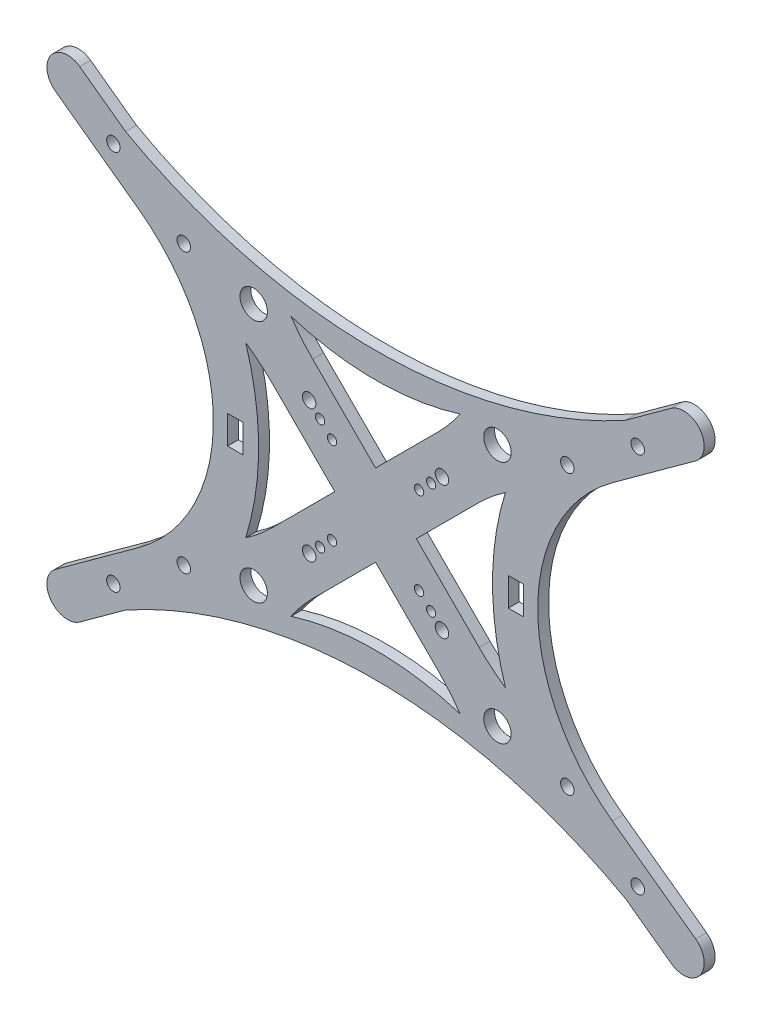
from build123d import *

# Parameters (mm, degrees)
SKETCH_7_R          = 1.075
SKETCH_7_R_2        = 1.55
SKETCH_7_R_3        = 3.15
SKETCH_7_R_4        = 3.150000003
EXTRUDE_2_5_DEPTH   = 2.5
CUT_EXTRUDE_2_DEPTH = 95.113928094
SKETCH_8_W          = 3.5
SKETCH_8_H          = 6.5
CUT_EXTRUDE_3_DEPTH = 95.113928094


with BuildPart() as part:
    # 草图7 → 主结构-厚度还是得2.5, 不然铝柱不好选 (new body)
    with BuildSketch(Plane.XY):
        with BuildLine():
            Line((-67.948496874, -55.238795586), (-57.42060576, -47.589834961))
            ThreePointArc((-57.42060576, -47.589834961), (0, -32.757979874), (57.42060576, -47.589834961))
            Line((57.42060576, -47.589834961), (67.948496874, -55.238795586))
            ThreePointArc((67.948496874, -55.238795586), (74.583307546, -54.187944811), (73.532456771, -47.55313414))
            Line((73.532456771, -47.55313414), (54.395000648, -33.648958388))
            ThreePointArc((54.395000648, -33.648958388), (37.25, 0), (54.395000648, 33.648958388))
            Line((54.395000648, 33.648958388), (73.532456771, 47.55313414))
            ThreePointArc((73.532456771, 47.55313414), (74.583307546, 54.187944811), (67.948496874, 55.238795586))
            Line((67.948496874, 55.238795586), (57.42060576, 47.589834961))
            ThreePointArc((57.42060576, 47.589834961), (0, 32.757979874), (-57.42060576, 47.589834961))
            Line((-57.42060576, 47.589834961), (-67.948496874, 55.238795586))
            ThreePointArc((-67.948496874, 55.238795586), (-74.583307546, 54.187944811), (-73.532456771, 47.55313414))
            Line((-73.532456771, 47.55313414), (-54.395000648, 33.648958388))
            ThreePointArc((-54.395000648, 33.648958388), (-37.25, 0), (-54.395000648, -33.648958388))
            Line((-54.395000648, -33.648958388), (-73.532456771, -47.55313414))
            ThreePointArc((-73.532456771, -47.55313414), (-74.583307546, -54.187944811), (-67.948496874, -55.238795586))
        make_face()
        with Locations((10, 10)):
            Circle(SKETCH_7_R, mode=Mode.SUBTRACT)
        with Locations((12.75, 12.75)):
            Circle(SKETCH_7_R, mode=Mode.SUBTRACT)
        with Locations((15.25, 15.25)):
            Circle(SKETCH_7_R_2, mode=Mode.SUBTRACT)
        with Locations((15.25, -15.25)):
            Circle(SKETCH_7_R_2, mode=Mode.SUBTRACT)
        with Locations((12.75, -12.75)):
            Circle(SKETCH_7_R, mode=Mode.SUBTRACT)
        with Locations((10, -10)):
            Circle(SKETCH_7_R, mode=Mode.SUBTRACT)
        with Locations((28, -28)):
            Circle(SKETCH_7_R_3, mode=Mode.SUBTRACT)
        with Locations((28, 28)):
            Circle(SKETCH_7_R_4, mode=Mode.SUBTRACT)
        with Locations((60.224561343, 43.755705046)):
            Circle(SKETCH_7_R_2, mode=Mode.SUBTRACT)
        with Locations((-60.224561343, 43.755705046)):
            Circle(SKETCH_7_R_2, mode=Mode.SUBTRACT)
        with Locations((-28, 28)):
            Circle(SKETCH_7_R_4, mode=Mode.SUBTRACT)
        with Locations((-28, -28)):
            Circle(SKETCH_7_R_3, mode=Mode.SUBTRACT)
        with Locations((-10, -10)):
            Circle(SKETCH_7_R, mode=Mode.SUBTRACT)
        with Locations((-12.75, -12.75)):
            Circle(SKETCH_7_R, mode=Mode.SUBTRACT)
        with Locations((-15.25, -15.25)):
            Circle(SKETCH_7_R_2, mode=Mode.SUBTRACT)
        with Locations((-15.25, 15.25)):
            Circle(SKETCH_7_R_2, mode=Mode.SUBTRACT)
        with Locations((-12.75, 12.75)):
            Circle(SKETCH_7_R, mode=Mode.SUBTRACT)
        with Locations((-10, 10)):
            Circle(SKETCH_7_R, mode=Mode.SUBTRACT)
        with Locations((60.224561343, -43.755705046)):
            Circle(SKETCH_7_R_2, mode=Mode.SUBTRACT)
        with Locations((44.044221455, -32)):
            Circle(SKETCH_7_R_2, mode=Mode.SUBTRACT)
        with Locations((44.044221455, 32)):
            Circle(SKETCH_7_R_2, mode=Mode.SUBTRACT)
        with Locations((-44.044221455, 32)):
            Circle(SKETCH_7_R_2, mode=Mode.SUBTRACT)
        with Locations((-60.224561343, -43.755705046)):
            Circle(SKETCH_7_R_2, mode=Mode.SUBTRACT)
        with Locations((-44.044221455, -32)):
            Circle(SKETCH_7_R_2, mode=Mode.SUBTRACT)
    extrude(amount=EXTRUDE_2_5_DEPTH)

    # 草图6 → 切除-拉伸2 (cut, through all)
    with BuildSketch(Plane.XY):
        with BuildLine():
            Line((-23.801448899, 14.429581723), (-9.371867176, 0))
            Line((-9.371867176, 0), (-23.801448899, -14.429581723))
            ThreePointArc((-23.801448899, -14.429581723), (-26.692624222, -17.058284994), (-29.820182402, -19.400795498))
            ThreePointArc((-29.820182402, -19.400795498), (-26.863678166, 0), (-29.820182402, 19.400795498))
            ThreePointArc((-29.820182402, 19.400795498), (-26.692624222, 17.058284994), (-23.801448899, 14.429581723))
        make_face()
        with BuildLine():
            Line((14.429581723, 23.801448899), (0, 9.371867176))
            Line((0, 9.371867176), (-14.429581723, 23.801448899))
            ThreePointArc((-14.429581723, 23.801448899), (-17.058284994, 26.692624222), (-19.400795498, 29.820182402))
            ThreePointArc((-19.400795498, 29.820182402), (0, 26.863678166), (19.400795498, 29.820182402))
            ThreePointArc((19.400795498, 29.820182402), (17.058284994, 26.692624222), (14.429581723, 23.801448899))
        make_face()
        with BuildLine():
            Line((23.801448899, -14.429581723), (9.371867176, 0))
            Line((9.371867176, 0), (23.801448899, 14.429581723))
            ThreePointArc((23.801448899, 14.429581723), (26.692624222, 17.058284994), (29.820182402, 19.400795498))
            ThreePointArc((29.820182402, 19.400795498), (26.863678166, 0), (29.820182402, -19.400795498))
            ThreePointArc((29.820182402, -19.400795498), (26.692624222, -17.058284994), (23.801448899, -14.429581723))
        make_face()
        with BuildLine():
            Line((-14.429581723, -23.801448899), (0, -9.371867176))
            Line((0, -9.371867176), (14.429581723, -23.801448899))
            ThreePointArc((14.429581723, -23.801448899), (17.058284994, -26.692624222), (19.400795498, -29.820182402))
            ThreePointArc((19.400795498, -29.820182402), (0, -26.863678166), (-19.400795498, -29.820182402))
            ThreePointArc((-19.400795498, -29.820182402), (-17.058284994, -26.692624222), (-14.429581723, -23.801448899))
        make_face()
    extrude(amount=CUT_EXTRUDE_2_DEPTH, mode=Mode.SUBTRACT)

    # 草图8 → 切除-拉伸3 (cut, through all)
    with BuildSketch(Plane.XY):
        with Locations((32.25, 0)):
            Rectangle(SKETCH_8_W, SKETCH_8_H)
        with Locations((-32.25, 0)):
            Rectangle(SKETCH_8_W, SKETCH_8_H)
    extrude(amount=CUT_EXTRUDE_3_DEPTH, mode=Mode.SUBTRACT)


solid = part.part
